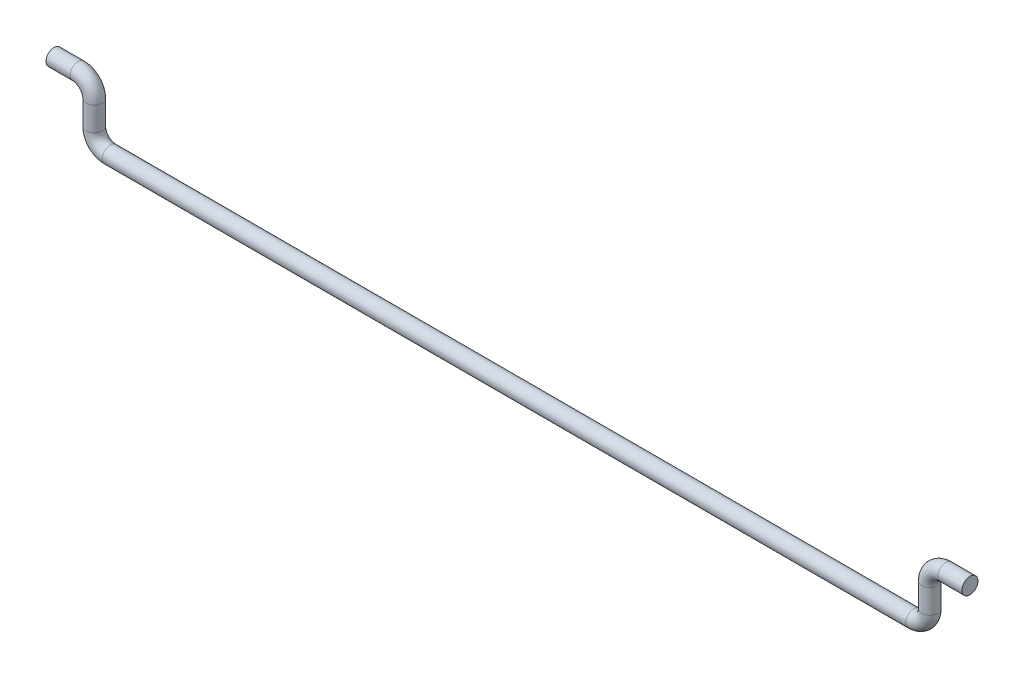
from build123d import *

# Parameters (mm, degrees)
SKETCH3_R = 1


with BuildPart() as part:
    # Sweep2: sweep along a path in Sketch1
    with BuildLine(Plane.XY) as sweep2_path:
        Line((-107, 7), (-104, 7))
        ThreePointArc((-104, 7), (-102.585786438, 6.414213562), (-102, 5))
        Line((-102, 5), (-102, 2))
        ThreePointArc((-102, 2), (-101.414213562, 0.585786438), (-100, 0))
        Line((-100, 0), (0, 0))
        ThreePointArc((0, 0), (1.414213562, 0.585786438), (2, 2))
        Line((2, 2), (2, 5))
        ThreePointArc((2, 5), (2.585786438, 6.414213562), (4, 7))
        Line((4, 7), (7, 7))
    # Sketch3 → Sweep2 (sweep)
    with BuildSketch(Plane(origin=(7, 0, 0), x_dir=(0, 0, -1), z_dir=(1, 0, 0))):
        with Locations((0.430401407, 7)):
            Circle(SKETCH3_R)
    sweep(path=sweep2_path.line)


solid = part.part
